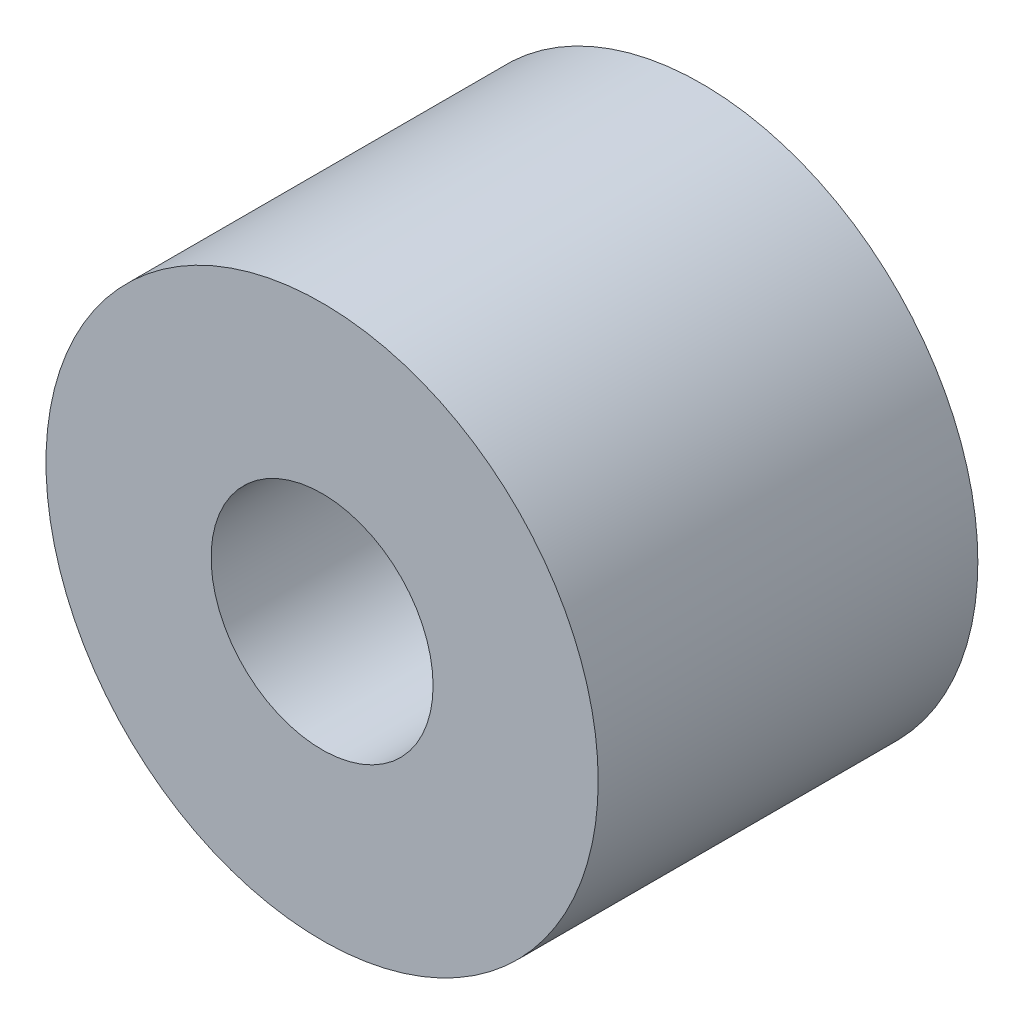
from build123d import *

# Parameters (mm, degrees)
SKETCH1_R                   = 6.35
BOSS_EXTRUDE1_DEPTH         = 4.365625
TAP_DRILL_FOR_1_4_20_TAP1_D = 5.1054


with BuildPart() as part:
    # Sketch1 → Boss-Extrude1 (new, symmetric)
    with BuildSketch(Plane.XY):
        Circle(SKETCH1_R)
    extrude(amount=BOSS_EXTRUDE1_DEPTH, both=True)

    # Tap Drill for 1/4-20 Tap1 (through all)
    with Locations(Plane.XY.offset(4.365625)):
        with Locations((0, 0)):
            Hole(TAP_DRILL_FOR_1_4_20_TAP1_D / 2)


solid = part.part
